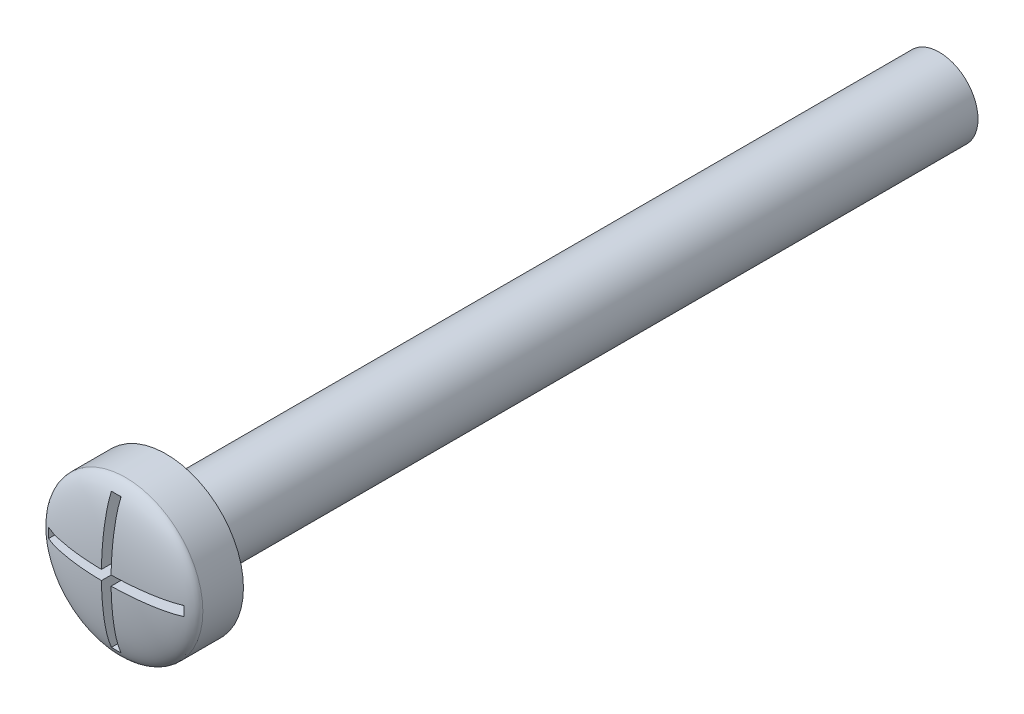
from build123d import *

# Parameters (mm, degrees)
BOSS_EXTRUDE3_START = -1
SKETCH1_R           = 4
BOSS_EXTRUDE3_DEPTH = 2.1
DOME1_FACE_RADIUS   = 4
DOME1_HEIGHT        = 1
SKETCH4_R           = 2
BOSS_EXTRUDE4_DEPTH = 40
CUT_EXTRUDE1_DEPTH  = 1


with BuildPart() as part:
    # Sketch1 → Boss-Extrude3 (new body)
    with BuildSketch(Plane.XY.offset(BOSS_EXTRUDE3_START)):
        Circle(SKETCH1_R)
    extrude(amount=-BOSS_EXTRUDE3_DEPTH)

    # Dome1: an elliptical dome of height H over a round flat face of radius A is half a spheroid: the quarter ellipse of half axes A and H revolved about the face's axis
    with BuildSketch(Plane((0, 0, -1), x_dir=(0, 1, 0), z_dir=(1, 0, 0)), mode=Mode.PRIVATE) as dome1_quarter:
        Ellipse(DOME1_FACE_RADIUS, DOME1_HEIGHT)
        Rectangle(DOME1_FACE_RADIUS, DOME1_HEIGHT, align=(Align.MIN, Align.MIN), mode=Mode.INTERSECT)
    revolve(dome1_quarter.sketch, axis=Axis((0, 0, -1), (0, 0, 1)))

    # Sketch4 → Boss-Extrude4 (add)
    with BuildSketch(Plane(origin=(0, 0, -3.1), x_dir=(-1, 0, 0), z_dir=(0, 0, -1))):
        Circle(SKETCH4_R)
    extrude(amount=BOSS_EXTRUDE4_DEPTH)

    # Sketch5 → Cut-Extrude1 (cut)
    with BuildSketch(Plane.XY):
        Polygon((0.25, 3.5), (-0.25, 3.5), (-0.25, 0.25), (-3.5, 0.25), (-3.5, -0.25), (-0.25, -0.25), (-0.25, -3.5), (0.25, -3.5), (0.25, -0.25), (3.5, -0.25), (3.5, 0.25), (0.25, 0.25), align=None)
    extrude(amount=-CUT_EXTRUDE1_DEPTH, mode=Mode.SUBTRACT)


solid = part.part
